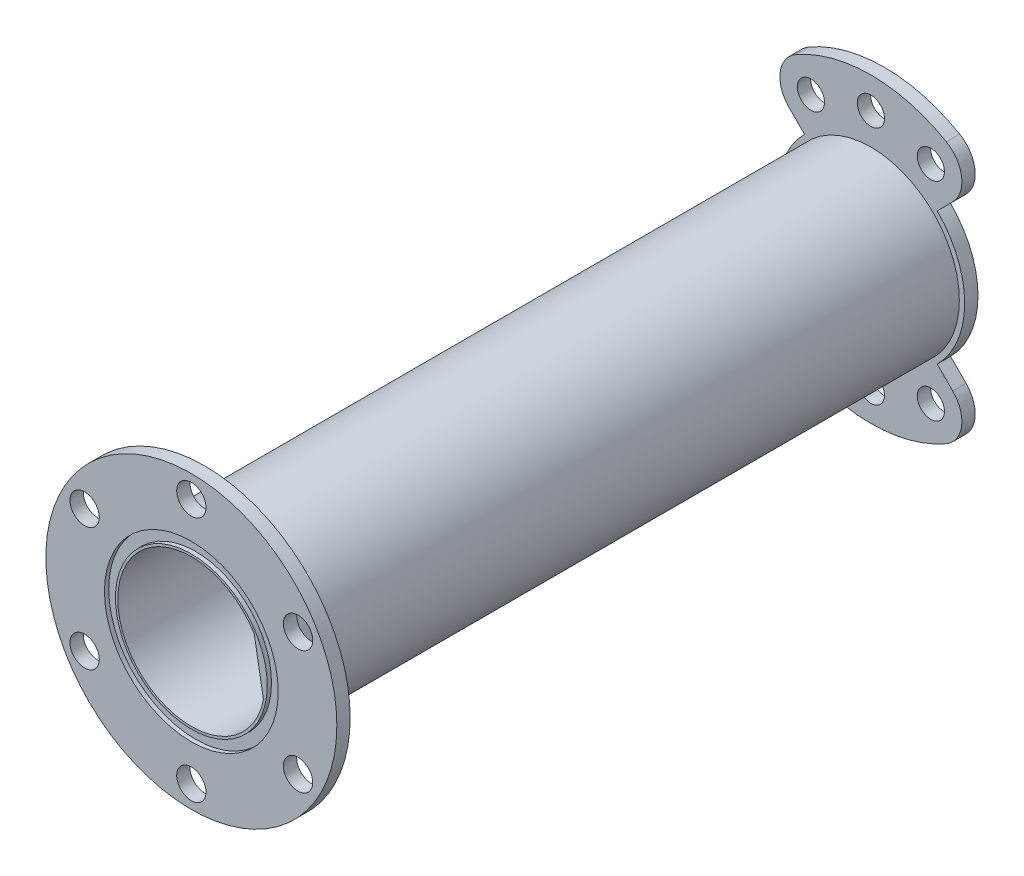
from build123d import *
from build123d.topology import SkipClean

# Parameters (mm, degrees)
SKETCH1_R               = 21.082
SKETCH1_R_2             = 17.526
BOSS_EXTRUDE1_DEPTH     = 254
BOSS_EXTRUDE2_START     = 6.35
SKETCH2_R               = 21.082
BOSS_EXTRUDE2_DEPTH     = 6.35
SKETCH3_R               = 25.868376463
CUT_EXTRUDE1_DEPTH      = 127
SKETCH4_R               = 34.925
SKETCH4_R_2             = 19.091061219
BOSS_EXTRUDE3_DEPTH     = 3.175
CUT_EXTRUDE2_DEPTH      = 143.203142546
CIRPATTERN1_COUNT       = 12
SKETCH6_R               = 34.925
SKETCH6_R_2             = 3.175
SKETCH6_R_3             = 21.082
BOSS_EXTRUDE5_DEPTH     = 130.175
SKETCH7_R               = 17.526
CUT_EXTRUDE3_DEPTH      = 143.203142546
SKETCH8_R               = 6.694074497
BOSS_EXTRUDE6_DEPTH     = 6.35
SKETCH9_R               = 62.865218318
SKETCH9_R_2             = 21.082
CUT_EXTRUDE4_DEPTH      = 120.65
SKETCH10_R              = 10.091708754
CUT_EXTRUDE5_DEPTH      = 143.203142546
CUT_EXTRUDE6_START      = -3.175
SKETCH11_R              = 34.925
SKETCH11_R_2            = 21.082
CUT_EXTRUDE6_DEPTH      = 3.175
SKETCH12_R              = 34.925
SKETCH12_R_2            = 21.082
CUT_EXTRUDE7_DEPTH      = 3.175
BOSS_EXTRUDE7_START     = -133.35
SKETCH13_R              = 17.526
SKETCH13_R_2            = 15.875
BOSS_EXTRUDE7_DEPTH     = 133.35
SKETCH14_R              = 21.082
SKETCH14_R_2            = 17.907
CUT_EXTRUDE8_DEPTH      = 127
CUT_EXTRUDE9_DEPTH      = 143.203142546
CUT_EXTRUDE9_DEPTH_BACK = 143.203142546
SKETCH15_R              = 3.175
BOSS_EXTRUDE8_START     = -3.175
BOSS_EXTRUDE8_DEPTH     = 3.175
SKETCH17_R              = 21.082
SKETCH17_R_2            = 17.907
BOSS_EXTRUDE9_DEPTH     = 127
SKETCH18_R              = 17.526
CUT_EXTRUDE10_DEPTH     = 140.808015407
SKETCH19_R              = 20.701
SKETCH19_R_2            = 18.0848
CUT_EXTRUDE11_DEPTH     = 1.016
SKETCH20_R              = 22.352
SKETCH20_R_2            = 20.701
BOSS_EXTRUDE10_DEPTH    = 3.175
CUT_EXTRUDE12_START     = -1.016
SKETCH21_R              = 20.701
SKETCH21_R_2            = 18.0848
CUT_EXTRUDE12_DEPTH     = 1.016
BOSS_EXTRUDE11_START    = -3.175
SKETCH22_R              = 22.352
SKETCH22_R_2            = 21.082
BOSS_EXTRUDE11_DEPTH    = 3.175
SKETCH24_R              = 42.506009091
SKETCH24_R_2            = 34.671
CUT_EXTRUDE13_DEPTH     = 25.4
SKETCH25_R              = 34.671
SKETCH25_R_2            = 22.352
BOSS_EXTRUDE12_DEPTH    = 3.175
CUT_EXTRUDE17_DEPTH     = 3.175
CIRPATTERN3_COUNT       = 6
BOSS_EXTRUDE13_START    = -133.35
BOSS_EXTRUDE13_DEPTH    = 133.35
SKETCH33_R              = 20.701
SKETCH33_R_2            = 18.0848
BOSS_EXTRUDE14_DEPTH    = 31.75
SKETCH35_R              = 18.0848
BOSS_EXTRUDE16_DEPTH    = 31.75
SKETCH36_R              = 3.175
SKETCH36_R_2            = 20.701
BOSS_EXTRUDE17_DEPTH    = 31.75
CUT_EXTRUDE18_OUTLINE_W = 14.888754214
CUT_EXTRUDE18_OUTLINE_H = 31.75
SKETCH38_R              = 3.2385
CUT_EXTRUDE19_DEPTH     = 25.4
SKETCH39_R              = 3.4925
CUT_EXTRUDE20_DEPTH     = 25.4


# Read off the part's stored shape, not the designer's step: Cut-Extrude18
with BuildPart() as part:
    # Sketch1 → Boss-Extrude1 (new body)
    with BuildSketch(Plane.XY):
        Circle(SKETCH1_R)
        Circle(SKETCH1_R_2, mode=Mode.SUBTRACT)
    extrude(amount=BOSS_EXTRUDE1_DEPTH)

    # Sketch2 → Boss-Extrude2 (add)
    with BuildSketch(Plane(origin=(0, 0, 0), x_dir=(-1, 0, 0), z_dir=(0, 0, -1)).offset(BOSS_EXTRUDE2_START)):
        Circle(SKETCH2_R)
    extrude(amount=-BOSS_EXTRUDE2_DEPTH)

    # Sketch3 → Cut-Extrude1 (cut)
    with BuildSketch(Plane.XY.offset(254)):
        Circle(SKETCH3_R)
    extrude(amount=-CUT_EXTRUDE1_DEPTH, mode=Mode.SUBTRACT)

    # Sketch4 → Boss-Extrude3 (add)
    with BuildSketch(Plane.XY.offset(127)):
        Circle(SKETCH4_R)
        Circle(SKETCH4_R_2, mode=Mode.SUBTRACT)
    extrude(amount=-BOSS_EXTRUDE3_DEPTH)

    # Sketch5 → Cut-Extrude2 (cut, through all)
    with BuildSketch(Plane.XY.offset(127)):
        with BuildLine():
            ThreePointArc((0, 31.75), (-3.175, 28.575), (0, 25.4))
            Line((0, 25.4), (0, 31.75))
        make_face()
        with BuildLine():
            Line((0, 31.75), (0, 25.4))
            ThreePointArc((0, 25.4), (2.24506403, 26.32993597), (3.175, 28.575))
            ThreePointArc((3.175, 28.575), (2.24506403, 30.82006403), (0, 31.75))
        make_face()
    cut_extrude2 = extrude(amount=-CUT_EXTRUDE2_DEPTH, mode=Mode.SUBTRACT)

    # CirPattern1: Cut-Extrude2 ×12 about axis
    cirpattern1_axis = Axis((0, 0, 0), (0, 0, 1))
    for i in range(1, CIRPATTERN1_COUNT):
        add(cut_extrude2.rotate(cirpattern1_axis, i * 360 / CIRPATTERN1_COUNT), mode=Mode.SUBTRACT)

    # Sketch6 → Boss-Extrude5 (add)
    with SkipClean():  # the faces are left unmerged after this step: merging them gives an invalid solid
        with BuildSketch(Plane(origin=(0, 0, 123.825), x_dir=(-1, 0, 0), z_dir=(0, 0, -1))):
            with Locations(Location((0, 0, 0), (0, 0, 180))):
                Circle(SKETCH6_R)
            with Locations(Location((-14.2875, -24.746675913, 0), (0, 0, 330))):
                Circle(SKETCH6_R_2, mode=Mode.SUBTRACT)
            with Locations(Location((-24.746675913, -14.2875, 0), (0, 0, 300))):
                Circle(SKETCH6_R_2, mode=Mode.SUBTRACT)
            with Locations(Location((-28.575, 0, 0), (0, 0, 270))):
                Circle(SKETCH6_R_2, mode=Mode.SUBTRACT)
            with Locations((0, -28.575)):
                Circle(SKETCH6_R_2, mode=Mode.SUBTRACT)
            with Locations(Location((14.2875, -24.746675913, 0), (0, 0, 30))):
                Circle(SKETCH6_R_2, mode=Mode.SUBTRACT)
            with Locations(Location((24.746675913, -14.2875, 0), (0, 0, 60))):
                Circle(SKETCH6_R_2, mode=Mode.SUBTRACT)
            with Locations(Location((-24.746675913, 14.2875, 0), (0, 0, 240))):
                Circle(SKETCH6_R_2, mode=Mode.SUBTRACT)
            with Locations(Location((-14.2875, 24.746675913, 0), (0, 0, 210))):
                Circle(SKETCH6_R_2, mode=Mode.SUBTRACT)
            Circle(SKETCH6_R_3, mode=Mode.SUBTRACT)
            with Locations(Location((28.575, 0, 0), (0, 0, 90))):
                Circle(SKETCH6_R_2, mode=Mode.SUBTRACT)
            with Locations(Location((24.746675913, 14.2875, 0), (0, 0, 120))):
                Circle(SKETCH6_R_2, mode=Mode.SUBTRACT)
            with Locations(Location((0, 28.575, 0), (0, 0, 180))):
                Circle(SKETCH6_R_2, mode=Mode.SUBTRACT)
            with Locations(Location((14.2875, 24.746675913, 0), (0, 0, 150))):
                Circle(SKETCH6_R_2, mode=Mode.SUBTRACT)
        extrude(amount=BOSS_EXTRUDE5_DEPTH)

    # Sketch7 → Cut-Extrude3 (cut, through all)
    with SkipClean():  # the faces are left unmerged after this step: merging them gives an invalid solid
        with BuildSketch(Plane(origin=(0, 0, -6.35), x_dir=(-1, 0, 0), z_dir=(0, 0, -1))):
            Circle(SKETCH7_R)
        extrude(amount=-CUT_EXTRUDE3_DEPTH, mode=Mode.SUBTRACT)

    # Sketch9 → Cut-Extrude4 (cut)
    with BuildSketch(Plane(origin=(0, 0, 120.65), x_dir=(-1, 0, 0), z_dir=(0, 0, -1))):
        Circle(SKETCH9_R)
        Circle(SKETCH9_R_2, mode=Mode.SUBTRACT)
    extrude(amount=CUT_EXTRUDE4_DEPTH, mode=Mode.SUBTRACT)

    # Sketch11 → Cut-Extrude6 (cut)
    with BuildSketch(Plane(origin=(0, 0, 120.65), x_dir=(-1, 0, 0), z_dir=(0, 0, -1)).offset(CUT_EXTRUDE6_START)):
        with Locations(Location((0, 0, 0), (0, 0, 180))):
            Circle(SKETCH11_R)
        Circle(SKETCH11_R_2, mode=Mode.SUBTRACT)
    extrude(amount=CUT_EXTRUDE6_DEPTH, mode=Mode.SUBTRACT)

    # Sketch12 → Cut-Extrude7 (cut)
    with BuildSketch(Plane.XY):
        Circle(SKETCH12_R)
        Circle(SKETCH12_R_2, mode=Mode.SUBTRACT)
    extrude(amount=-CUT_EXTRUDE7_DEPTH, mode=Mode.SUBTRACT)

    # Sketch13 → Boss-Extrude7 (add)
    with SkipClean():  # the faces are left unmerged after this step: merging them gives an invalid solid
        with BuildSketch(Plane.XY.offset(127).offset(BOSS_EXTRUDE7_START)):
            Circle(SKETCH13_R)
            Circle(SKETCH13_R_2, mode=Mode.SUBTRACT)
        extrude(amount=BOSS_EXTRUDE7_DEPTH)

    # Sketch14 → Cut-Extrude8 (cut)
    with BuildSketch(Plane(origin=(0, 0, 123.825), x_dir=(-1, 0, 0), z_dir=(0, 0, -1))):
        Circle(SKETCH14_R)
        with Locations(Location((0, 0, 0), (0, 0, 180))):
            Circle(SKETCH14_R_2, mode=Mode.SUBTRACT)
    extrude(amount=CUT_EXTRUDE8_DEPTH, mode=Mode.SUBTRACT)

    # Sketch15 → Cut-Extrude9 (cut, two sides: drawn at the far end of the back side and taken through both)
    # profile 1 of 6: a face of its own
    with BuildSketch(Plane(origin=(0, 0, -6.35), x_dir=(-1, 0, 0), z_dir=(0, 0, -1)).offset(-CUT_EXTRUDE9_DEPTH_BACK)):
        with BuildLine():
            ThreePointArc((-14.907225161, -14.907225161), (-21.082, 0), (-14.907225161, 14.907225161))
            Line((-14.907225161, 14.907225161), (-19.517087957, 19.517087957))
            Line((-19.517087957, 19.517087957), (-24.695704333, 24.695704333))
            ThreePointArc((-24.695704333, 24.695704333), (-34.925, 0), (-24.695704333, -24.695704333))
            Line((-24.695704333, -24.695704333), (-19.517087952, -19.517087952))
            Line((-19.517087952, -19.517087952), (-14.907225161, -14.907225161))
        make_face()
        with Locations((-24.746675913, -14.2875)):
            Circle(SKETCH15_R, mode=Mode.SUBTRACT)
        with Locations((-28.575, 0)):
            Circle(SKETCH15_R, mode=Mode.SUBTRACT)
        with Locations((-24.746675913, 14.2875)):
            Circle(SKETCH15_R, mode=Mode.SUBTRACT)
    # profile 2 of 6: a face of its own
    with BuildSketch(Plane(origin=(0, 0, -6.35), x_dir=(-1, 0, 0), z_dir=(0, 0, -1)).offset(-CUT_EXTRUDE9_DEPTH_BACK)):
        with BuildLine():
            Line((-24.695704333, 24.695704333), (-19.517087957, 19.517087957))
            ThreePointArc((-19.517087957, 19.517087957), (-21.576944301, 23.497203158), (-20.960180597, 27.936113802))
            ThreePointArc((-20.960180597, 27.936113802), (-22.885366953, 26.382107657), (-24.695704333, 24.695704333))
        make_face()
    # profile 3 of 6: a face of its own
    with BuildSketch(Plane(origin=(0, 0, -6.35), x_dir=(-1, 0, 0), z_dir=(0, 0, -1)).offset(-CUT_EXTRUDE9_DEPTH_BACK)):
        with BuildLine():
            ThreePointArc((-20.960180597, -27.936113802), (-21.576944301, -23.497203155), (-19.517087952, -19.517087952))
            Line((-19.517087952, -19.517087952), (-24.695704333, -24.695704333))
            ThreePointArc((-24.695704333, -24.695704333), (-22.885366953, -26.382107657), (-20.960180597, -27.936113802))
        make_face()
    # profile 4 of 6: a face of its own
    with BuildSketch(Plane(origin=(0, 0, -6.35), x_dir=(-1, 0, 0), z_dir=(0, 0, -1)).offset(-CUT_EXTRUDE9_DEPTH_BACK)):
        with BuildLine():
            Line((24.695704333, -24.695704333), (19.517088, -19.517088))
            ThreePointArc((19.517088, -19.517088), (21.120285957, -21.916443334), (21.683254214, -24.746675913))
            ThreePointArc((21.683254214, -24.746675913), (21.500220916, -26.381863173), (20.960180597, -27.936113802))
            ThreePointArc((20.960180597, -27.936113802), (22.885366953, -26.382107657), (24.695704333, -24.695704333))
        make_face()
    # profile 5 of 6: a face of its own
    with BuildSketch(Plane(origin=(0, 0, -6.35), x_dir=(-1, 0, 0), z_dir=(0, 0, -1)).offset(-CUT_EXTRUDE9_DEPTH_BACK)):
        with BuildLine():
            ThreePointArc((14.907225161, 14.907225161), (16.72547512, 12.833908446), (18.257547563, 10.541))
            ThreePointArc((18.257547563, 10.541), (20.36364827, 5.456423109), (21.082, 0))
            ThreePointArc((21.082, 0), (19.477228304, -8.067732121), (14.907225161, -14.907225161))
            Line((14.907225161, -14.907225161), (19.517088, -19.517088))
            Line((19.517088, -19.517088), (24.695704333, -24.695704333))
            ThreePointArc((24.695704333, -24.695704333), (32.266492673, -13.365218875), (34.925, 0))
            ThreePointArc((34.925, 0), (32.266492673, 13.365218875), (24.695704333, 24.695704333))
            Line((24.695704333, 24.695704333), (19.517087973, 19.517087973))
            Line((19.517087973, 19.517087973), (14.907225161, 14.907225161))
        make_face()
        with Locations((24.746675913, -14.2875)):
            Circle(SKETCH15_R, mode=Mode.SUBTRACT)
        with Locations((28.575, 0)):
            Circle(SKETCH15_R, mode=Mode.SUBTRACT)
        with BuildLine():
            ThreePointArc((27.921675913, 14.2875), (25.568426381, 11.220685502), (21.997045256, 12.7))
            ThreePointArc((21.997045256, 12.7), (23.924925445, 17.354314498), (27.921675913, 14.2875))
        make_face(mode=Mode.SUBTRACT)
    # profile 6 of 6: a face of its own
    with BuildSketch(Plane(origin=(0, 0, -6.35), x_dir=(-1, 0, 0), z_dir=(0, 0, -1)).offset(-CUT_EXTRUDE9_DEPTH_BACK)):
        with BuildLine():
            ThreePointArc((21.683254214, 24.746675913), (21.12028595, 21.916443316), (19.517087973, 19.517087973))
            Line((19.517087973, 19.517087973), (24.695704333, 24.695704333))
            ThreePointArc((24.695704333, 24.695704333), (22.885366953, 26.382107657), (20.960180597, 27.936113802))
            ThreePointArc((20.960180597, 27.936113802), (21.500220916, 26.381863173), (21.683254214, 24.746675913))
        make_face()
    extrude(amount=CUT_EXTRUDE9_DEPTH + CUT_EXTRUDE9_DEPTH_BACK, mode=Mode.SUBTRACT)

    # Sketch16 → Boss-Extrude8 (add)
    with BuildSketch(Plane(origin=(0, 0, -6.35), x_dir=(-1, 0, 0), z_dir=(0, 0, -1)).offset(BOSS_EXTRUDE8_START)):
        with BuildLine():
            ThreePointArc((-17.985374262, 31.151588585), (-19.716304798, 29.769151284), (-20.960180597, 27.936113802))
            ThreePointArc((-20.960180597, 27.936113802), (0, 34.925), (20.960180597, 27.936113802))
            ThreePointArc((20.960180597, 27.936113802), (19.716305931, 29.76915006), (17.985377151, 31.151586917))
            ThreePointArc((17.985377151, 31.151586917), (1.668e-06, 35.970754214), (-17.985374262, 31.151588585))
        make_face()
        with BuildLine():
            ThreePointArc((-20.960180597, -27.936113802), (-19.716305978, -29.769150009), (-17.98537727, -31.151586848))
            ThreePointArc((-17.98537727, -31.151586848), (1.298e-06, -35.970754214), (17.985379519, -31.15158555))
            ThreePointArc((17.985379519, -31.15158555), (19.716306859, -29.769149056), (20.960180597, -27.936113802))
            ThreePointArc((20.960180597, -27.936113802), (0, -34.925), (-20.960180597, -27.936113802))
        make_face()
    extrude(amount=BOSS_EXTRUDE8_DEPTH)

    # Sketch17 → Boss-Extrude9 (add)
    with SkipClean():  # the faces are left unmerged after this step: merging them gives an invalid solid
        with BuildSketch(Plane(origin=(0, 0, 123.825), x_dir=(-1, 0, 0), z_dir=(0, 0, -1))):
            with Locations(Location((0, 0, 0), (0, 0, 315))):
                Circle(SKETCH17_R)
            Circle(SKETCH17_R_2, mode=Mode.SUBTRACT)
        extrude(amount=BOSS_EXTRUDE9_DEPTH)

    # Sketch18 → Cut-Extrude10 (cut, through all)
    with SkipClean():  # the faces are left unmerged after this step: merging them gives an invalid solid
        with BuildSketch(Plane.XY.offset(127)):
            Circle(SKETCH18_R)
        extrude(amount=-CUT_EXTRUDE10_DEPTH, mode=Mode.SUBTRACT)

    # Sketch19 → Cut-Extrude11 (cut)
    with SkipClean():  # the faces are left unmerged after this step: merging them gives an invalid solid
        with BuildSketch(Plane.XY.offset(127)):
            Circle(SKETCH19_R)
            Circle(SKETCH19_R_2, mode=Mode.SUBTRACT)
        extrude(amount=-CUT_EXTRUDE11_DEPTH, mode=Mode.SUBTRACT)

    # Sketch20 → Boss-Extrude10 (add)
    with SkipClean():  # the faces are left unmerged after this step: merging them gives an invalid solid
        with BuildSketch(Plane.XY.offset(127)):
            Circle(SKETCH20_R)
            Circle(SKETCH20_R_2, mode=Mode.SUBTRACT)
        extrude(amount=-BOSS_EXTRUDE10_DEPTH)

    # Sketch21 → Cut-Extrude12 (cut)
    with SkipClean():  # the faces are left unmerged after this step: merging them gives an invalid solid
        with BuildSketch(Plane(origin=(0, 0, -6.35), x_dir=(-1, 0, 0), z_dir=(0, 0, -1)).offset(CUT_EXTRUDE12_START)):
            with Locations(Location((0, 0, 0), (0, 0, 180))):
                Circle(SKETCH21_R)
            with Locations(Location((0, 0, 0), (0, 0, 180))):
                Circle(SKETCH21_R_2, mode=Mode.SUBTRACT)
        extrude(amount=CUT_EXTRUDE12_DEPTH, mode=Mode.SUBTRACT)

    # Sketch22 → Boss-Extrude11 (add)
    with BuildSketch(Plane(origin=(0, 0, -6.35), x_dir=(-1, 0, 0), z_dir=(0, 0, -1)).offset(BOSS_EXTRUDE11_START)):
        Circle(SKETCH22_R)
        Circle(SKETCH22_R_2, mode=Mode.SUBTRACT)
    extrude(amount=BOSS_EXTRUDE11_DEPTH)

    # Sketch24 → Cut-Extrude13 (cut)
    with BuildSketch(Plane.XY.offset(127)):
        Circle(SKETCH24_R)
        Circle(SKETCH24_R_2, mode=Mode.SUBTRACT)
    extrude(amount=-CUT_EXTRUDE13_DEPTH, mode=Mode.SUBTRACT)

    # Sketch25 → Boss-Extrude12 (add)
    with BuildSketch(Plane.XY.offset(127)):
        Circle(SKETCH25_R)
        Circle(SKETCH25_R_2, mode=Mode.SUBTRACT)
    extrude(amount=-BOSS_EXTRUDE12_DEPTH)

    # Sketch29 → Cut-Extrude17 (cut)
    with BuildSketch(Plane.XY.offset(127)):
        with BuildLine():
            ThreePointArc((0, 32.7279), (-3.3655, 29.3624), (0, 25.9969))
            Line((0, 25.9969), (0, 32.7279))
        make_face()
        with BuildLine():
            Line((0, 32.7279), (0, 25.9969))
            ThreePointArc((0, 25.9969), (2.379767872, 26.982632128), (3.3655, 29.3624))
            ThreePointArc((3.3655, 29.3624), (2.379767872, 31.742167872), (0, 32.7279))
        make_face()
    cut_extrude17 = extrude(amount=-CUT_EXTRUDE17_DEPTH, mode=Mode.SUBTRACT)

    # CirPattern3: Cut-Extrude17 ×6 about axis
    cirpattern3_axis = Axis((0, 0, 0), (0, 0, 1))
    for i in range(1, CIRPATTERN3_COUNT):
        add(cut_extrude17.rotate(cirpattern3_axis, i * 360 / CIRPATTERN3_COUNT), mode=Mode.SUBTRACT)

    # Sketch31 → Boss-Extrude13 (add)
    with BuildSketch(Plane(origin=(0, 0, -6.35), x_dir=(-1, 0, 0), z_dir=(0, 0, -1)).offset(BOSS_EXTRUDE13_START)):
        with BuildLine():
            ThreePointArc((-14.984348104, 9.090103845), (-17.259740679, 3.043357962), (-17.18967996, -3.416954619))
            Line((-17.18967996, -3.416954619), (-14.984348104, 9.090103845))
        make_face()
    extrude(amount=BOSS_EXTRUDE13_DEPTH)

    # Sketch33 → Boss-Extrude14 (add)
    with BuildSketch(Plane(origin=(0, 0, -5.334), x_dir=(-1, 0, 0), z_dir=(0, 0, -1))):
        with Locations(Location((0, 0, 0), (0, 0, 180))):
            Circle(SKETCH33_R)
        with Locations(Location((0, 0, 0), (0, 0, 180))):
            Circle(SKETCH33_R_2, mode=Mode.SUBTRACT)
    extrude(amount=BOSS_EXTRUDE14_DEPTH)

    # Sketch35 → Boss-Extrude16 (add)
    with BuildSketch(Plane(origin=(0, 0, -6.35), x_dir=(-1, 0, 0), z_dir=(0, 0, -1))):
        with Locations(Location((0, 0, 0), (0, 0, 180))):
            Circle(SKETCH35_R)
        with BuildLine():
            Line((-17.18967996, -3.416954619), (-14.984348104, 9.090103845))
            ThreePointArc((-14.984348104, 9.090103845), (17.259740679, -3.043357962), (-17.18967996, -3.416954619))
        make_face(mode=Mode.SUBTRACT)
    extrude(amount=BOSS_EXTRUDE16_DEPTH)

    # Sketch36 → Boss-Extrude17 (add)
    with BuildSketch(Plane(origin=(0, 0, -6.35), x_dir=(-1, 0, 0), z_dir=(0, 0, -1))):
        with BuildLine():
            ThreePointArc((17.985377107, -31.151586942), (21.619982511, -25.712015549), (19.517087957, -19.517087957))
            Line((19.517087957, -19.517087957), (15.805250773, -15.805250773))
            ThreePointArc((15.805250773, -15.805250773), (22.352, 0), (15.805250773, 15.805250773))
            Line((15.805250773, 15.805250773), (19.517087957, 19.517087957))
            ThreePointArc((19.517087957, 19.517087957), (21.619982511, 25.712015549), (17.985377107, 31.151586942))
            ThreePointArc((17.985377107, 31.151586942), (0, 35.970754214), (-17.985377107, 31.151586942))
            ThreePointArc((-17.985377107, 31.151586942), (-21.619982511, 25.712015549), (-19.517087957, 19.517087957))
            Line((-19.517087957, 19.517087957), (-15.805250773, 15.805250773))
            ThreePointArc((-15.805250773, 15.805250773), (-22.352, 0), (-15.805250773, -15.805250773))
            Line((-15.805250773, -15.805250773), (-19.517087957, -19.517087957))
            ThreePointArc((-19.517087957, -19.517087957), (-21.619982511, -25.712015549), (-17.985377107, -31.151586942))
            ThreePointArc((-17.985377107, -31.151586942), (0, -35.970754214), (17.985377107, -31.151586942))
        make_face()
        with Locations(Location((0, -28.575, 0), (0, 0, 180))):
            Circle(SKETCH36_R, mode=Mode.SUBTRACT)
        with Locations(Location((-14.2875, -24.746675913, 0), (0, 0, 180))):
            Circle(SKETCH36_R, mode=Mode.SUBTRACT)
        with Locations(Location((14.2875, 24.746675913, 0), (0, 0, 180))):
            Circle(SKETCH36_R, mode=Mode.SUBTRACT)
        with Locations(Location((0, 28.575, 0), (0, 0, 180))):
            Circle(SKETCH36_R, mode=Mode.SUBTRACT)
        with Locations(Location((-14.2875, 24.746675913, 0), (0, 0, 180))):
            Circle(SKETCH36_R, mode=Mode.SUBTRACT)
        with Locations(Location((0, 0, 0), (0, 0, 180))):
            Circle(SKETCH36_R_2, mode=Mode.SUBTRACT)
        with Locations(Location((14.2875, -24.746675913, 0), (0, 0, 180))):
            Circle(SKETCH36_R, mode=Mode.SUBTRACT)
    extrude(amount=BOSS_EXTRUDE17_DEPTH)

    # Cut-Extrude18 outline → Cut-Extrude18 (revolve, cut)
    with SkipClean():  # the faces are left unmerged after this step: merging them gives an invalid solid
        with BuildSketch(Plane.XZ):
            with Locations((28.526377107, -19.05)):
                Rectangle(CUT_EXTRUDE18_OUTLINE_W, CUT_EXTRUDE18_OUTLINE_H)
        revolve(axis=Axis((0, 0, 0), (0, 0, 1)), mode=Mode.SUBTRACT)

    # Sketch38 → Cut-Extrude19 (cut)
    with SkipClean():  # the faces are left unmerged after this step: merging them gives an invalid solid
        with BuildSketch(Plane(origin=(0, 0, -38.1), x_dir=(-1, 0, 0), z_dir=(0, 0, -1))):
            with Locations((-14.2875, 24.746675913)):
                Circle(SKETCH38_R)
            with Locations((0, 28.575)):
                Circle(SKETCH38_R)
            with Locations((14.2875, 24.746675913)):
                Circle(SKETCH38_R)
            with Locations((14.2875, -24.746675913)):
                Circle(SKETCH38_R)
            with Locations((0, -28.575)):
                Circle(SKETCH38_R)
            with Locations((-14.2875, -24.746675913)):
                Circle(SKETCH38_R)
        extrude(amount=-CUT_EXTRUDE19_DEPTH, mode=Mode.SUBTRACT)

    # Sketch39 → Cut-Extrude20 (cut)
    with SkipClean():  # the faces are left unmerged after this step: merging them gives an invalid solid
        with BuildSketch(Plane.XY.offset(127)):
            with Locations((0, 29.3624)):
                Circle(SKETCH39_R)
            with Locations((25.428584316, 14.6812)):
                Circle(SKETCH39_R)
            with Locations((25.428584316, -14.6812)):
                Circle(SKETCH39_R)
            with Locations((0, -29.3624)):
                Circle(SKETCH39_R)
            with Locations((-25.428584316, -14.6812)):
                Circle(SKETCH39_R)
            with Locations((-25.428584316, 14.6812)):
                Circle(SKETCH39_R)
        extrude(amount=-CUT_EXTRUDE20_DEPTH, mode=Mode.SUBTRACT)


with BuildPart() as body_2:
    # Sketch8 → Boss-Extrude6 (new body)
    with BuildSketch(Plane.XY.offset(127)):
        Circle(SKETCH8_R)
    extrude(amount=-BOSS_EXTRUDE6_DEPTH)

    # Sketch10 → Cut-Extrude5 (cut, through all)
    with BuildSketch(Plane.XY.offset(127)):
        Circle(SKETCH10_R)
    extrude(amount=-CUT_EXTRUDE5_DEPTH, mode=Mode.SUBTRACT)


solid = part.part
